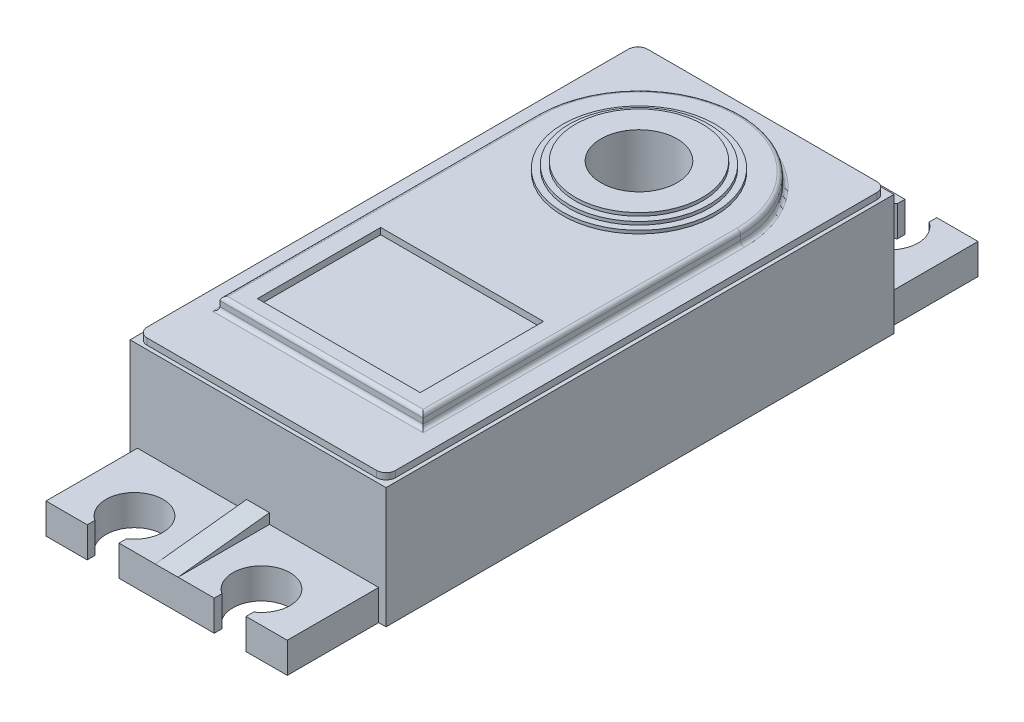
from build123d import *

# Parameters (mm, degrees)
BASES_W                              = 20.16
BASES_H                              = 40
BASE_DEPTH                           = 10
SHAFTHOLES_R                         = 3
SHAFT_HOLE_DEPTH                     = 25.527666012
MOUNTINGTABS_W                       = 19
MOUNTINGTABS_H                       = 2.4
MOUNTING_TAB_DEPTH                   = 7.2
MOUNTING_HOLE_DEPTH                  = 30.986770416
BOTTOMALIGNHOLES_R                   = 0.7
BOTTOM_ALIGN_HOLE_DEPTH              = 0.5
TRIANGULAR_TAB_DEPTH                 = 0.9
MOUNTING_TAB_FEATURES_M_COPY_1_DEPTH = 30.986770416
BORDERCUTS_W                         = 20.16
BORDERCUTS_H                         = 40
BORDERCUTS_W_2                       = 19.56
BORDERCUTS_H_2                       = 39.4
BORDER_CUT_DEPTH                     = 0.5
BORDER_CUT_F_R                       = 0.75
SHELL3_OUTLINE_W                     = 17.96
SHELL3_OUTLINE_H                     = 37.8
SHELL3_OUTLINE_R                     = 3.8
SHELL3_DEPTH                         = 9.2
SHELL3_2_OUTLINE_W                   = 18.56
SHELL3_2_OUTLINE_H                   = 38.4
SHELL3_2_OUTLINE_W_2                 = 17.96
SHELL3_2_OUTLINE_H_2                 = 37.8
SHELL3_2_DEPTH                       = 8.7
SHELL3_3_DEPTH                       = 1.6
SHELL3_START                         = 1.3
SHELL3_4_DEPTH                       = 0.3
SHELL3_START_2                       = 1.6
SHELL3_5_OUTLINE_W                   = 0.2
SHELL3_5_OUTLINE_H                   = 7.2
SHELL3_5_DEPTH                       = 0.083965765
SHELL3_START_3                       = -0.1
SHELL3_6_DEPTH                       = 0.2
SKETCH2_R                            = 4.5
CUT_EXTRUDE1_DEPTH                   = 3
SKETCH3_R                            = 6
SKETCH3_R_2                          = 5.5
BOSS_EXTRUDE1_DEPTH                  = 1.25
SKETCH3_4_R                          = 5.5
BOSS_EXTRUDE2_DEPTH                  = 1.5
SKETCH3_5_R                          = 5
BOSS_EXTRUDE3_DEPTH                  = 1.75
CUT_EXTRUDE7_DEPTH                   = 31.68299855
CUT_EXTRUDE7_DEPTH_BACK              = 31.68299855
SKETCH3_6_R                          = 3
BOSS_EXTRUDE4_DEPTH                  = 1
SKETCH6_R                            = 3
CUT_EXTRUDE8_DEPTH                   = 20
SKETCH7_W                            = 12.822327898
SKETCH7_H                            = 9.709392801
CUT_EXTRUDE9_DEPTH                   = 0.5
FILLET2_R                            = 0.3


with BuildPart() as part:
    # BaseS → BASE (new body)
    with BuildSketch(Plane(origin=(0, 0, 0), x_dir=(1, 0, 0), z_dir=(0, 1, 0))):
        Rectangle(BASES_W, BASES_H)
    extrude(amount=BASE_DEPTH)

    # ShaftHoleS → SHAFT HOLE (cut, through all)
    with BuildSketch(Plane(origin=(0, 10, 0), x_dir=(1, 0, 0), z_dir=(0, 1, 0))):
        with Locations(Location((0, 10, 0), (0, 0, 270))):
            Circle(SHAFTHOLES_R)
    extrude(amount=-SHAFT_HOLE_DEPTH, mode=Mode.SUBTRACT)

    # MountingTabS → MOUNTING TAB (add)
    with BuildSketch(Plane.XY.offset(20)):
        with Locations((0, 1.2)):
            Rectangle(MOUNTINGTABS_W, MOUNTINGTABS_H)
    mounting_tab = extrude(amount=MOUNTING_TAB_DEPTH)

    # MountingHoleS → MOUNTING HOLE (cut, through all)
    with BuildSketch(Plane(origin=(0, 2.4, 0), x_dir=(1, 0, 0), z_dir=(0, 1, 0))):
        with BuildLine():
            Line((-6.25, -26.6), (-6.25, -27.2))
            Line((-6.25, -27.2), (-3.75, -27.2))
            Line((-3.75, -27.2), (-3.75, -26.6))
            ThreePointArc((-3.75, -26.6), (-5, -22.479171307), (-6.25, -26.6))
        make_face()
    mounting_hole = extrude(amount=-MOUNTING_HOLE_DEPTH, mode=Mode.SUBTRACT)

    # MH M: MOUNTING HOLE across plane
    add(mounting_hole.mirror(Plane(origin=(0, 0, 0), x_dir=(0, 0, 1), z_dir=(1, 0, 0))), mode=Mode.SUBTRACT)

    # BottomAlignHoleS → BOTTOM ALIGN HOLE (cut)
    with BuildSketch(Plane.XZ):
        with Locations(Location((0, 25.2, 0), (0, 0, 270))):
            Circle(BOTTOMALIGNHOLES_R)
    bottom_align_hole = extrude(amount=-BOTTOM_ALIGN_HOLE_DEPTH, mode=Mode.SUBTRACT)

    # TriangularTabS → TRIANGULAR TAB (add, symmetric)
    with BuildSketch(Plane(origin=(0, 0, 0), x_dir=(0, 0, -1), z_dir=(1, 0, 0))):
        Polygon((-20, 2.4), (-27.2, 2.4), (-20, 3.2), align=None)
    triangular_tab = extrude(amount=TRIANGULAR_TAB_DEPTH, both=True)

    # MOUNTING TAB FEATURES M: MOUNTING TAB, MOUNTING HOLE, BOTTOM ALIGN HOLE, TRIANGULAR TAB across plane
    add(mounting_tab.mirror(Plane.XY))
    add(mounting_hole.mirror(Plane.XY), mode=Mode.SUBTRACT)
    add(bottom_align_hole.mirror(Plane.XY), mode=Mode.SUBTRACT)
    add(triangular_tab.mirror(Plane.XY))

    # MOUNTING TAB FEATURES M copy 1 sketch → MOUNTING TAB FEATURES M copy 1 (cut, through all)
    with BuildSketch(Plane(origin=(0, 2.4, 0), x_dir=(-1, 0, 0), z_dir=(0, 1, 0))):
        with BuildLine():
            Line((-6.25, -26.6), (-6.25, -27.2))
            Line((-6.25, -27.2), (-3.75, -27.2))
            Line((-3.75, -27.2), (-3.75, -26.6))
            ThreePointArc((-3.75, -26.6), (-5, -22.479171307), (-6.25, -26.6))
        make_face()
    extrude(amount=-MOUNTING_TAB_FEATURES_M_COPY_1_DEPTH, mode=Mode.SUBTRACT)

    # BorderCutS → BORDER CUT (cut)
    with BuildSketch(Plane(origin=(0, 10, 0), x_dir=(1, 0, 0), z_dir=(0, 1, 0))):
        Rectangle(BORDERCUTS_W, BORDERCUTS_H)
        Rectangle(BORDERCUTS_W_2, BORDERCUTS_H_2, mode=Mode.SUBTRACT)
    extrude(amount=-BORDER_CUT_DEPTH, mode=Mode.SUBTRACT)

    # BORDER CUT F
    border_cut_f_edges = [part.edges().sort_by_distance(p)[0] for p in [
        (9.78, 9.75, -19.7),
        (9.78, 9.75, 19.7),
        (-9.78, 9.75, 19.7),
        (-9.78, 9.75, -19.7),
    ]]
    fillet(border_cut_f_edges, radius=BORDER_CUT_F_R)

    # Shell3: read off the stored shape, not the designer's step
    # Shell3 outline → Shell3 (cut)
    with BuildSketch(Plane(origin=(0, 0, 0), x_dir=(1, 0, 0), z_dir=(0, 1, 0))):
        Rectangle(SHELL3_OUTLINE_W, SHELL3_OUTLINE_H)
        with Locations((0, 10)):
            Circle(SHELL3_OUTLINE_R, mode=Mode.SUBTRACT)
    extrude(amount=SHELL3_DEPTH, mode=Mode.SUBTRACT)

    # Shell3 2 outline → Shell3 2 (cut)
    with BuildSketch(Plane(origin=(0, 0, 0), x_dir=(1, 0, 0), z_dir=(0, 1, 0))):
        Rectangle(SHELL3_2_OUTLINE_W, SHELL3_2_OUTLINE_H)
        Rectangle(SHELL3_2_OUTLINE_W_2, SHELL3_2_OUTLINE_H_2, mode=Mode.SUBTRACT)
    extrude(amount=SHELL3_2_DEPTH, mode=Mode.SUBTRACT)

    # Shell3 3 outline → Shell3 3 (cut)
    with BuildSketch(Plane(origin=(0, 0, 0), x_dir=(1, 0, 0), z_dir=(0, 1, 0))):
        with BuildLine():
            Line((8.7, 19.2), (8.7, 26.4))
            Line((8.7, 26.4), (7.5516331, 26.4))
            ThreePointArc((7.5516331, 26.4), (5, 21.679171307), (2.4483669, 26.4))
            Line((2.4483669, 26.4), (0.9, 26.4))
            ThreePointArc((0.9, 26.4), (0, 23.7), (-0.9, 26.4))
            Line((-0.9, 26.4), (-2.4483669, 26.4))
            ThreePointArc((-2.4483669, 26.4), (-5, 21.679171307), (-7.5516331, 26.4))
            Line((-7.5516331, 26.4), (-8.7, 26.4))
            Line((-8.7, 26.4), (-8.7, 19.2))
            Line((-8.7, 19.2), (8.7, 19.2))
        make_face()
        with BuildLine():
            Line((8.7, -26.4), (8.7, -19.2))
            Line((8.7, -19.2), (-8.7, -19.2))
            Line((-8.7, -19.2), (-8.7, -26.4))
            Line((-8.7, -26.4), (-7.5516331, -26.4))
            ThreePointArc((-7.5516331, -26.4), (-5, -21.679171307), (-2.4483669, -26.4))
            Line((-2.4483669, -26.4), (-0.9, -26.4))
            ThreePointArc((-0.9, -26.4), (0, -23.7), (0.9, -26.4))
            Line((0.9, -26.4), (2.4483669, -26.4))
            ThreePointArc((2.4483669, -26.4), (5, -21.679171307), (7.5516331, -26.4))
            Line((7.5516331, -26.4), (8.7, -26.4))
        make_face()
    extrude(amount=SHELL3_3_DEPTH, mode=Mode.SUBTRACT)

    # Shell3 4 outline → Shell3 4 (cut)
    with BuildSketch(Plane(origin=(0, 0, 0), x_dir=(1, 0, 0), z_dir=(0, 1, 0)).offset(SHELL3_START)):
        with BuildLine():
            Line((0.9, 26.4), (-0.9, 26.4))
            ThreePointArc((-0.9, 26.4), (0, 23.7), (0.9, 26.4))
        make_face()
        with BuildLine():
            ThreePointArc((0.9, -26.4), (0, -23.7), (-0.9, -26.4))
            Line((-0.9, -26.4), (0.9, -26.4))
        make_face()
    extrude(amount=SHELL3_4_DEPTH, mode=Mode.SUBTRACT)

    # Shell3 5 outline → Shell3 5 (cut)
    with BuildSketch(Plane(origin=(0, 0, 0), x_dir=(1, 0, 0), z_dir=(0, 1, 0)).offset(SHELL3_START_2)):
        with Locations((0, 22.8)):
            Rectangle(SHELL3_5_OUTLINE_W, SHELL3_5_OUTLINE_H)
        with Locations((0, -22.8)):
            Rectangle(SHELL3_5_OUTLINE_W, SHELL3_5_OUTLINE_H)
    extrude(amount=SHELL3_5_DEPTH, mode=Mode.SUBTRACT)

    # Shell3 6 outline → Shell3 6 (cut)
    with BuildSketch(Plane.YZ.offset(SHELL3_START_3)):
        Polygon((2.483965765, 19.2), (1.683965765, 26.4), (1.683965765, 19.2), align=None)
        Polygon((1.683965765, -19.2), (1.683965765, -26.4), (2.483965765, -19.2), align=None)
    extrude(amount=SHELL3_6_DEPTH, mode=Mode.SUBTRACT)

    # Sketch2 → Cut-Extrude1 (cut)
    with BuildSketch(Plane(origin=(0, 0, 0), x_dir=(-1, 0, 0), z_dir=(0, -1, 0))):
        with Locations((0, 10)):
            Circle(SKETCH2_R)
    extrude(amount=-CUT_EXTRUDE1_DEPTH, mode=Mode.SUBTRACT)

    # Sketch3 → Boss-Extrude1 (add)
    with BuildSketch(Plane(origin=(0, 10, 0), x_dir=(1, 0, 0), z_dir=(0, 1, 0))):
        with Locations(Location((0, 10, 0), (0, 0, 90))):
            Circle(SKETCH3_R)
        with Locations(Location((0, 10, 0), (0, 0, 270))):
            Circle(SKETCH3_R_2, mode=Mode.SUBTRACT)
    extrude(amount=BOSS_EXTRUDE1_DEPTH)

    # Sketch3<4> → Boss-Extrude2 (add)
    with BuildSketch(Plane(origin=(0, 10, 0), x_dir=(1, 0, 0), z_dir=(0, 1, 0))):
        with Locations(Location((0, 10, 0), (0, 0, 270))):
            Circle(SKETCH3_4_R)
    extrude(amount=BOSS_EXTRUDE2_DEPTH)

    # Sketch3<5> → Boss-Extrude3 (add)
    with BuildSketch(Plane(origin=(0, 10, 0), x_dir=(1, 0, 0), z_dir=(0, 1, 0))):
        with Locations(Location((0, 10, 0), (0, 0, 270))):
            Circle(SKETCH3_5_R)
    extrude(amount=BOSS_EXTRUDE3_DEPTH)

    # Sketch3<6> → Cut-Extrude7 (cut, two sides: drawn at the far end of the back side and taken through both)
    with BuildSketch(Plane(origin=(0, 10, 0), x_dir=(1, 0, 0), z_dir=(0, 1, 0)).offset(-CUT_EXTRUDE7_DEPTH_BACK)):
        with Locations(Location((0, 10, 0), (0, 0, 270))):
            Circle(SKETCH3_6_R)
    extrude(amount=CUT_EXTRUDE7_DEPTH + CUT_EXTRUDE7_DEPTH_BACK, mode=Mode.SUBTRACT)

    # Sketch5 → Boss-Extrude4 (add)
    with BuildSketch(Plane(origin=(0, 10, 0), x_dir=(1, 0, 0), z_dir=(0, 1, 0))):
        with BuildLine():
            Line((8, 10), (8, -15))
            Line((8, -15), (-8, -15))
            Line((-8, -15), (-8, 10))
            ThreePointArc((-8, 10), (0, 18), (8, 10))
        make_face()
    extrude(amount=BOSS_EXTRUDE4_DEPTH)

    # Sketch6 → Cut-Extrude8 (cut)
    with BuildSketch(Plane(origin=(0, 11, 0), x_dir=(1, 0, 0), z_dir=(0, 1, 0))):
        with Locations(Location((0, 10, 0), (0, 0, 270))):
            Circle(SKETCH6_R)
    extrude(amount=-CUT_EXTRUDE8_DEPTH, mode=Mode.SUBTRACT)

    # Sketch7 → Cut-Extrude9 (cut)
    with BuildSketch(Plane(origin=(0, 11, 0), x_dir=(1, 0, 0), z_dir=(0, 1, 0))):
        with Locations((0.037058751, -8.819982774)):
            Rectangle(SKETCH7_W, SKETCH7_H)
    extrude(amount=-CUT_EXTRUDE9_DEPTH, mode=Mode.SUBTRACT)

    # Fillet2
    fillet2_edges = [part.edges().sort_by_distance(p)[0] for p in [
        (0, 10, -18),
        (-8, 10, 2.5),
        (0, 10, 15),
        (8, 10, 2.5),
        (0, 11, -18),
        (-8, 11, 2.5),
        (0, 11, 15),
        (8, 11, 2.5),
    ]]
    fillet(fillet2_edges, radius=FILLET2_R)


solid = part.part
